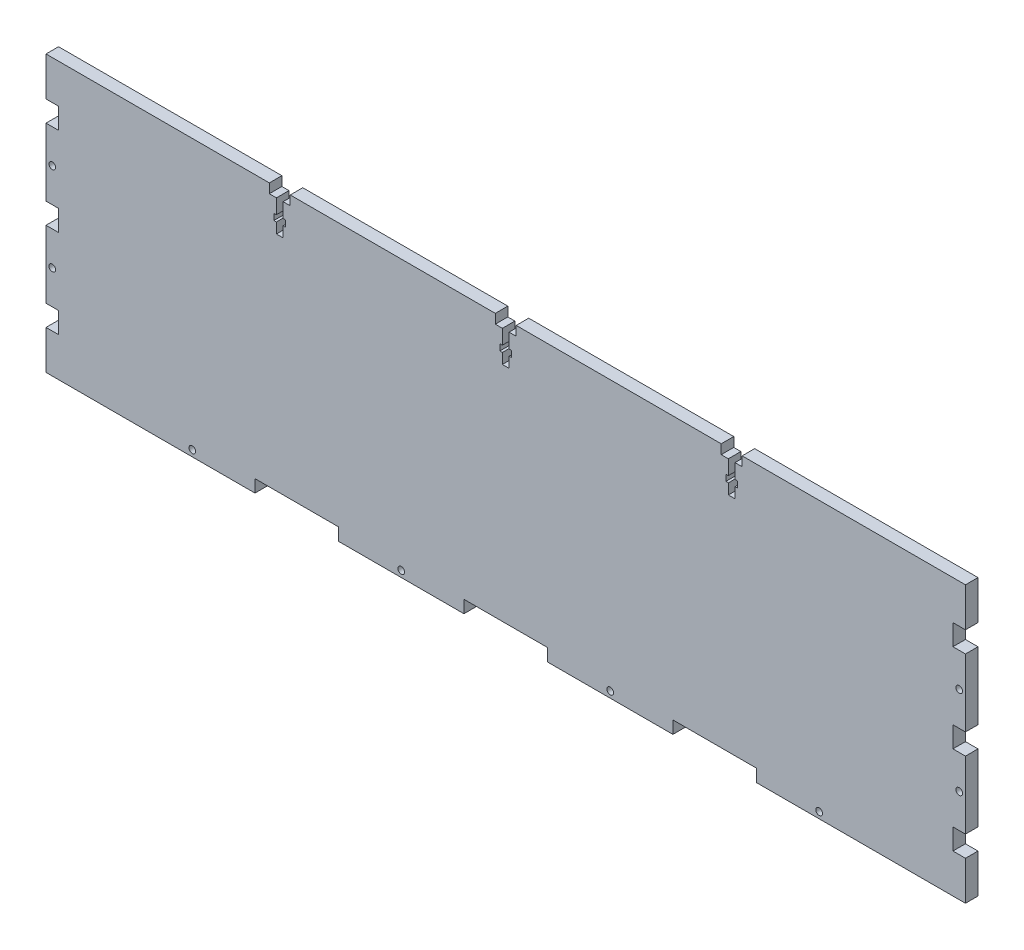
from build123d import *

# Parameters (mm, degrees)
SKETCH1_W           = 440
SKETCH1_H           = 132
BOSS_EXTRUDE1_DEPTH = 6
CUT_EXTRUDE1_REACH  = 231.765
SKETCH2_R           = 1.6
SKETCH2_W           = 6
SKETCH2_H           = 10
CUT_EXTRUDE2_REACH  = 231.765
SKETCH3_R           = 1.6
CUT_EXTRUDE3_REACH  = 231.765
SKETCH4_W           = 40
SKETCH4_H           = 6
SKETCH5_W           = 10
SKETCH5_H           = 6
CUT_EXTRUDE4_DEPTH  = 4.5
CUT_EXTRUDE5_REACH  = 231.765


with BuildPart() as part:
    # Sketch1 → Boss-Extrude1 (new body)
    with BuildSketch(Plane.XY):
        Rectangle(SKETCH1_W, SKETCH1_H)
    extrude(amount=BOSS_EXTRUDE1_DEPTH)

    # Sketch2 → Cut-Extrude1 (cut, up to next)
    with BuildSketch(Plane(origin=(0, 0, 0), x_dir=(-1, 0, 0), z_dir=(0, 0, -1)), mode=Mode.PRIVATE) as cut_extrude1_sk1:
        with Locations((217, 21.166064391)):
            Circle(SKETCH2_R)
    cut_extrude1_tool1 = extrude(cut_extrude1_sk1.sketch, amount=-CUT_EXTRUDE1_REACH, mode=Mode.PRIVATE) & part.part
    # Sketch2 → Cut-Extrude1 (cut, up to next)
    with BuildSketch(Plane(origin=(0, 0, 0), x_dir=(-1, 0, 0), z_dir=(0, 0, -1)), mode=Mode.PRIVATE) as cut_extrude1_sk2:
        with Locations((217, -21.166064391)):
            Circle(SKETCH2_R)
    cut_extrude1_tool2 = extrude(cut_extrude1_sk2.sketch, amount=-CUT_EXTRUDE1_REACH, mode=Mode.PRIVATE) & part.part
    # Sketch2 → Cut-Extrude1 (cut, up to next)
    with BuildSketch(Plane(origin=(0, 0, 0), x_dir=(-1, 0, 0), z_dir=(0, 0, -1)), mode=Mode.PRIVATE) as cut_extrude1_sk3:
        with Locations((-217, 21.166064391)):
            Circle(SKETCH2_R)
    cut_extrude1_tool3 = extrude(cut_extrude1_sk3.sketch, amount=-CUT_EXTRUDE1_REACH, mode=Mode.PRIVATE) & part.part
    # Sketch2 → Cut-Extrude1 (cut, up to next)
    with BuildSketch(Plane(origin=(0, 0, 0), x_dir=(-1, 0, 0), z_dir=(0, 0, -1)), mode=Mode.PRIVATE) as cut_extrude1_sk4:
        with Locations((-217, -21.166064391)):
            Circle(SKETCH2_R)
    cut_extrude1_tool4 = extrude(cut_extrude1_sk4.sketch, amount=-CUT_EXTRUDE1_REACH, mode=Mode.PRIVATE) & part.part
    # Sketch2 → Cut-Extrude1 (cut, up to next)
    with BuildSketch(Plane(origin=(0, 0, 0), x_dir=(-1, 0, 0), z_dir=(0, 0, -1)), mode=Mode.PRIVATE) as cut_extrude1_sk5:
        with Locations((217, 42.332128782)):
            Rectangle(SKETCH2_W, SKETCH2_H)
    cut_extrude1_tool5 = extrude(cut_extrude1_sk5.sketch, amount=-CUT_EXTRUDE1_REACH, mode=Mode.PRIVATE) & part.part
    # Sketch2 → Cut-Extrude1 (cut, up to next)
    with BuildSketch(Plane(origin=(0, 0, 0), x_dir=(-1, 0, 0), z_dir=(0, 0, -1)), mode=Mode.PRIVATE) as cut_extrude1_sk6:
        with Locations((217, -42.332128782)):
            Rectangle(SKETCH2_W, SKETCH2_H)
    cut_extrude1_tool6 = extrude(cut_extrude1_sk6.sketch, amount=-CUT_EXTRUDE1_REACH, mode=Mode.PRIVATE) & part.part
    # Sketch2 → Cut-Extrude1 (cut, up to next)
    with BuildSketch(Plane(origin=(0, 0, 0), x_dir=(-1, 0, 0), z_dir=(0, 0, -1)), mode=Mode.PRIVATE) as cut_extrude1_sk7:
        with Locations((-217, -42.332128782)):
            Rectangle(SKETCH2_W, SKETCH2_H)
    cut_extrude1_tool7 = extrude(cut_extrude1_sk7.sketch, amount=-CUT_EXTRUDE1_REACH, mode=Mode.PRIVATE) & part.part
    # Sketch2 → Cut-Extrude1 (cut, up to next)
    with BuildSketch(Plane(origin=(0, 0, 0), x_dir=(-1, 0, 0), z_dir=(0, 0, -1)), mode=Mode.PRIVATE) as cut_extrude1_sk8:
        with Locations((-217, 42.332128782)):
            Rectangle(SKETCH2_W, SKETCH2_H)
    cut_extrude1_tool8 = extrude(cut_extrude1_sk8.sketch, amount=-CUT_EXTRUDE1_REACH, mode=Mode.PRIVATE) & part.part
    # Sketch2 → Cut-Extrude1 (cut, up to next)
    with BuildSketch(Plane(origin=(0, 0, 0), x_dir=(-1, 0, 0), z_dir=(0, 0, -1)), mode=Mode.PRIVATE) as cut_extrude1_sk9:
        with Locations((217, 0)):
            Rectangle(SKETCH2_W, SKETCH2_H)
    cut_extrude1_tool9 = extrude(cut_extrude1_sk9.sketch, amount=-CUT_EXTRUDE1_REACH, mode=Mode.PRIVATE) & part.part
    # Sketch2 → Cut-Extrude1 (cut, up to next)
    with BuildSketch(Plane(origin=(0, 0, 0), x_dir=(-1, 0, 0), z_dir=(0, 0, -1)), mode=Mode.PRIVATE) as cut_extrude1_sk10:
        with Locations((-217, 0)):
            Rectangle(SKETCH2_W, SKETCH2_H)
    cut_extrude1_tool10 = extrude(cut_extrude1_sk10.sketch, amount=-CUT_EXTRUDE1_REACH, mode=Mode.PRIVATE) & part.part
    add(cut_extrude1_tool1.solids().sort_by_distance((-217, 21.166064, 0))[0], mode=Mode.SUBTRACT)
    add(cut_extrude1_tool2.solids().sort_by_distance((-217, -21.166064, 0))[0], mode=Mode.SUBTRACT)
    add(cut_extrude1_tool3.solids().sort_by_distance((217, 21.166064, 0))[0], mode=Mode.SUBTRACT)
    add(cut_extrude1_tool4.solids().sort_by_distance((217, -21.166064, 0))[0], mode=Mode.SUBTRACT)
    add(cut_extrude1_tool5.solids().sort_by_distance((-217, 42.332129, 0))[0], mode=Mode.SUBTRACT)
    add(cut_extrude1_tool6.solids().sort_by_distance((-217, -42.332129, 0))[0], mode=Mode.SUBTRACT)
    add(cut_extrude1_tool7.solids().sort_by_distance((217, -42.332129, 0))[0], mode=Mode.SUBTRACT)
    add(cut_extrude1_tool8.solids().sort_by_distance((217, 42.332129, 0))[0], mode=Mode.SUBTRACT)
    add(cut_extrude1_tool9.solids().sort_by_distance((-217, 0, 0))[0], mode=Mode.SUBTRACT)
    add(cut_extrude1_tool10.solids().sort_by_distance((217, 0, 0))[0], mode=Mode.SUBTRACT)

    # Sketch3 → Cut-Extrude2 (cut, up to next)
    with BuildSketch(Plane(origin=(0, 0, 0), x_dir=(-1, 0, 0), z_dir=(0, 0, -1)), mode=Mode.PRIVATE) as cut_extrude2_sk1:
        with Locations((-150, -63)):
            Circle(SKETCH3_R)
    cut_extrude2_tool1 = extrude(cut_extrude2_sk1.sketch, amount=-CUT_EXTRUDE2_REACH, mode=Mode.PRIVATE) & part.part
    # Sketch3 → Cut-Extrude2 (cut, up to next)
    with BuildSketch(Plane(origin=(0, 0, 0), x_dir=(-1, 0, 0), z_dir=(0, 0, -1)), mode=Mode.PRIVATE) as cut_extrude2_sk2:
        with Locations((-50, -63)):
            Circle(SKETCH3_R)
    cut_extrude2_tool2 = extrude(cut_extrude2_sk2.sketch, amount=-CUT_EXTRUDE2_REACH, mode=Mode.PRIVATE) & part.part
    # Sketch3 → Cut-Extrude2 (cut, up to next)
    with BuildSketch(Plane(origin=(0, 0, 0), x_dir=(-1, 0, 0), z_dir=(0, 0, -1)), mode=Mode.PRIVATE) as cut_extrude2_sk3:
        with Locations((50, -63)):
            Circle(SKETCH3_R)
    cut_extrude2_tool3 = extrude(cut_extrude2_sk3.sketch, amount=-CUT_EXTRUDE2_REACH, mode=Mode.PRIVATE) & part.part
    # Sketch3 → Cut-Extrude2 (cut, up to next)
    with BuildSketch(Plane(origin=(0, 0, 0), x_dir=(-1, 0, 0), z_dir=(0, 0, -1)), mode=Mode.PRIVATE) as cut_extrude2_sk4:
        with Locations((150, -63)):
            Circle(SKETCH3_R)
    cut_extrude2_tool4 = extrude(cut_extrude2_sk4.sketch, amount=-CUT_EXTRUDE2_REACH, mode=Mode.PRIVATE) & part.part
    add(cut_extrude2_tool1.solids().sort_by_distance((150, -63, 0))[0], mode=Mode.SUBTRACT)
    add(cut_extrude2_tool2.solids().sort_by_distance((50, -63, 0))[0], mode=Mode.SUBTRACT)
    add(cut_extrude2_tool3.solids().sort_by_distance((-50, -63, 0))[0], mode=Mode.SUBTRACT)
    add(cut_extrude2_tool4.solids().sort_by_distance((-150, -63, 0))[0], mode=Mode.SUBTRACT)

    # Sketch4 → Cut-Extrude3 (cut, up to next)
    with BuildSketch(Plane(origin=(0, 0, 0), x_dir=(-1, 0, 0), z_dir=(0, 0, -1)), mode=Mode.PRIVATE) as cut_extrude3_sk1:
        with Locations((100, -63)):
            Rectangle(SKETCH4_W, SKETCH4_H)
    cut_extrude3_tool1 = extrude(cut_extrude3_sk1.sketch, amount=-CUT_EXTRUDE3_REACH, mode=Mode.PRIVATE) & part.part
    # Sketch4 → Cut-Extrude3 (cut, up to next)
    with BuildSketch(Plane(origin=(0, 0, 0), x_dir=(-1, 0, 0), z_dir=(0, 0, -1)), mode=Mode.PRIVATE) as cut_extrude3_sk2:
        with Locations((0, -63)):
            Rectangle(SKETCH4_W, SKETCH4_H)
    cut_extrude3_tool2 = extrude(cut_extrude3_sk2.sketch, amount=-CUT_EXTRUDE3_REACH, mode=Mode.PRIVATE) & part.part
    # Sketch4 → Cut-Extrude3 (cut, up to next)
    with BuildSketch(Plane(origin=(0, 0, 0), x_dir=(-1, 0, 0), z_dir=(0, 0, -1)), mode=Mode.PRIVATE) as cut_extrude3_sk3:
        with Locations((-100, -63)):
            Rectangle(SKETCH4_W, SKETCH4_H)
    cut_extrude3_tool3 = extrude(cut_extrude3_sk3.sketch, amount=-CUT_EXTRUDE3_REACH, mode=Mode.PRIVATE) & part.part
    add(cut_extrude3_tool1.solids().sort_by_distance((-100, -63, 0))[0], mode=Mode.SUBTRACT)
    add(cut_extrude3_tool2.solids().sort_by_distance((0, -63, 0))[0], mode=Mode.SUBTRACT)
    add(cut_extrude3_tool3.solids().sort_by_distance((100, -63, 0))[0], mode=Mode.SUBTRACT)

    # Sketch5 → Cut-Extrude4 (cut)
    with BuildSketch(Plane(origin=(0, 66, 0), x_dir=(1, 0, 0), z_dir=(0, 1, 0))):
        with Locations((-108.125, -3)):
            Rectangle(SKETCH5_W, SKETCH5_H)
        with Locations((0, -3)):
            Rectangle(SKETCH5_W, SKETCH5_H)
        with Locations((108.125, -3)):
            Rectangle(SKETCH5_W, SKETCH5_H)
    extrude(amount=-CUT_EXTRUDE4_DEPTH, mode=Mode.SUBTRACT)

    # Sketch6 → Cut-Extrude5 (cut, up to next)
    with BuildSketch(Plane(origin=(0, 0, 0), x_dir=(-1, 0, 0), z_dir=(0, 0, -1)), mode=Mode.PRIVATE) as cut_extrude5_sk1:
        Polygon((-109.725, 61.5), (-109.725, 54.5), (-110.925, 54.5), (-110.925, 51.5), (-109.725, 51.5), (-109.725, 46.5), (-106.525, 46.5), (-106.525, 51.5), (-105.325, 51.5), (-105.325, 54.5), (-106.525, 54.5), (-106.525, 61.5), align=None)
    cut_extrude5_tool1 = extrude(cut_extrude5_sk1.sketch, amount=-CUT_EXTRUDE5_REACH, mode=Mode.PRIVATE) & part.part
    # Sketch6 → Cut-Extrude5 (cut, up to next)
    with BuildSketch(Plane(origin=(0, 0, 0), x_dir=(-1, 0, 0), z_dir=(0, 0, -1)), mode=Mode.PRIVATE) as cut_extrude5_sk2:
        Polygon((-1.595, 61.5), (-1.595, 54.5), (-2.795, 54.5), (-2.795, 51.5), (-1.595, 51.5), (-1.595, 46.5), (1.605, 46.5), (1.605, 51.5), (2.805, 51.5), (2.805, 54.5), (1.605, 54.5), (1.605, 61.5), align=None)
    cut_extrude5_tool2 = extrude(cut_extrude5_sk2.sketch, amount=-CUT_EXTRUDE5_REACH, mode=Mode.PRIVATE) & part.part
    # Sketch6 → Cut-Extrude5 (cut, up to next)
    with BuildSketch(Plane(origin=(0, 0, 0), x_dir=(-1, 0, 0), z_dir=(0, 0, -1)), mode=Mode.PRIVATE) as cut_extrude5_sk3:
        Polygon((106.535, 61.5), (106.535, 54.5), (105.335, 54.5), (105.335, 51.5), (106.535, 51.5), (106.535, 46.5), (109.735, 46.5), (109.735, 51.5), (110.935, 51.5), (110.935, 54.5), (109.735, 54.5), (109.735, 61.5), align=None)
    cut_extrude5_tool3 = extrude(cut_extrude5_sk3.sketch, amount=-CUT_EXTRUDE5_REACH, mode=Mode.PRIVATE) & part.part
    add(cut_extrude5_tool1.solids().sort_by_distance((108.125, 53.869565, 0))[0], mode=Mode.SUBTRACT)
    add(cut_extrude5_tool2.solids().sort_by_distance((-0.005, 53.869565, 0))[0], mode=Mode.SUBTRACT)
    add(cut_extrude5_tool3.solids().sort_by_distance((-108.135, 53.869565, 0))[0], mode=Mode.SUBTRACT)


solid = part.part
